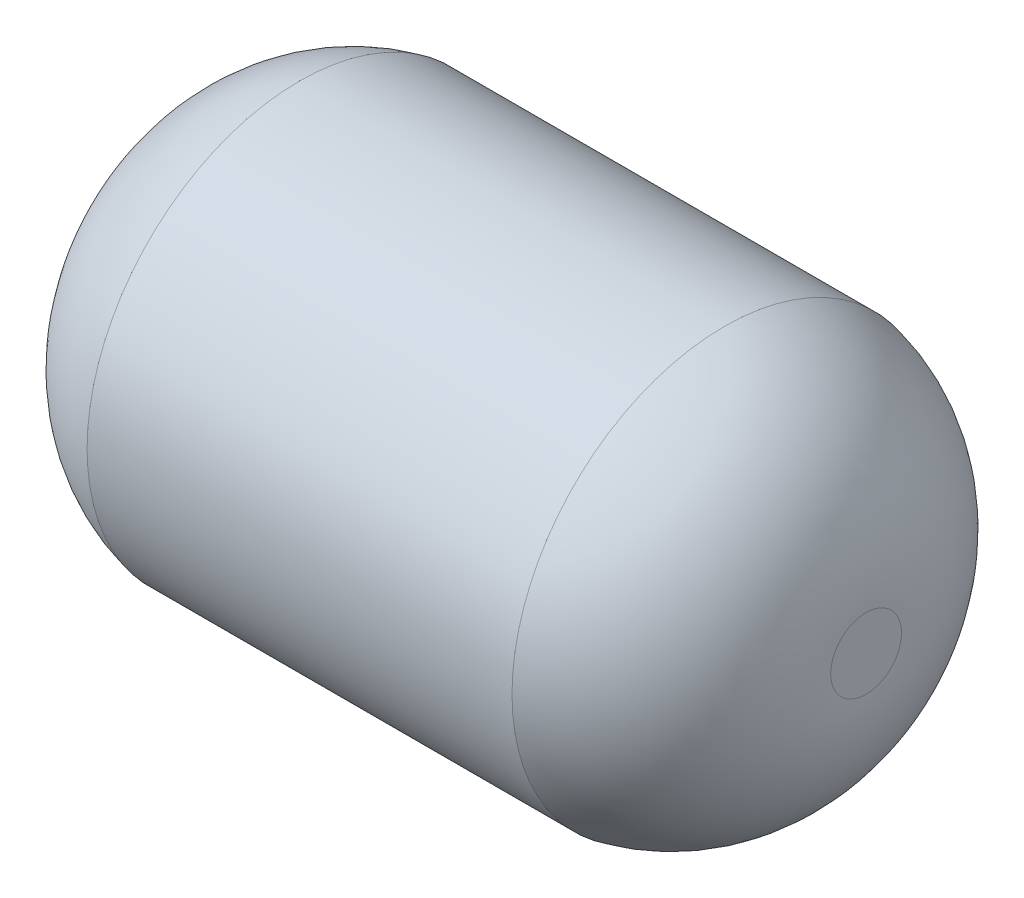
from build123d import *


with BuildPart() as part:
    # Sketch1 → Revolve-Thin1 (revolve)
    with BuildSketch(Plane(origin=(0, 0, 0), x_dir=(1, 0, 0), z_dir=(0, 1, 0))):
        with BuildLine():
            Line((0, 59), (59.896326585, 59))
            ThreePointArc((59.896326585, 59), (88.244744032, 41.525060748), (99, 10.007910772))
            Line((99, 10.007910772), (99, 0))
            Line((99, 0), (100, 0))
            Line((100, 0), (100, 10))
            ThreePointArc((100, 10), (88.991132396, 42.192905916), (60, 60))
            Line((60, 60), (0, 60))
            Line((0, 60), (0, 59))
        make_face()
    revolve_thin1 = revolve(axis=Axis((0, 0, 0), (1, 0, 0)))

    # Mirror1: Revolve-Thin1 across plane
    add(revolve_thin1.mirror(Plane(origin=(0, 0, -59), x_dir=(0, 0, 1), z_dir=(-1, 0, 0))))


solid = part.part
